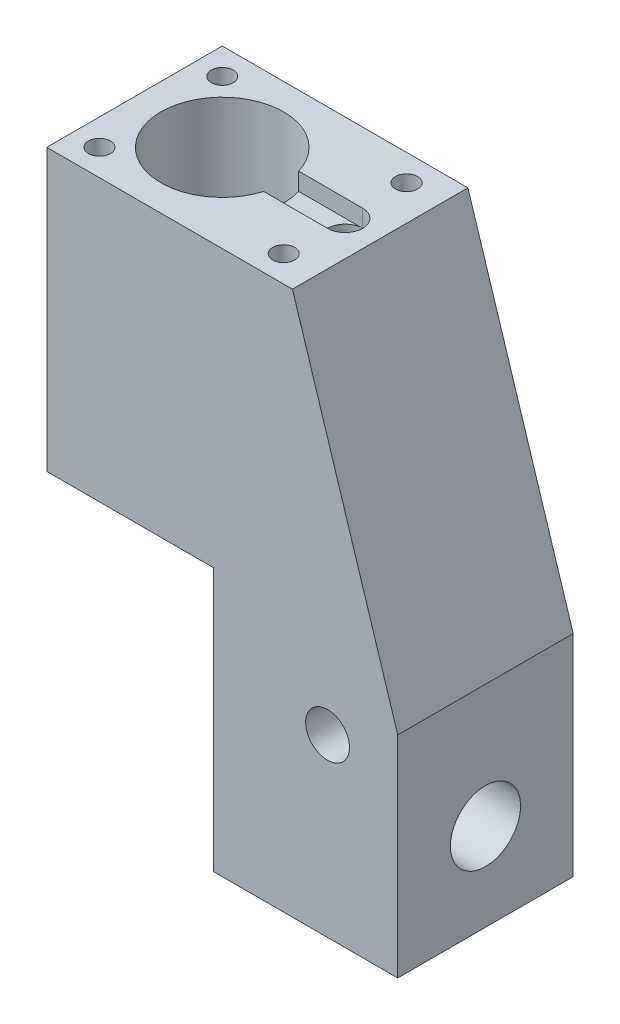
from build123d import *

# Parameters (mm, degrees)
SKETCH1_R             = 2.5
BOSS_EXTRUDE1_DEPTH   = 10
CUT_EXTRUDE1_DEPTH    = 75.458041876
CUT_EXTRUDE2_DEPTH    = 2
M3_TAPPED_HOLE1_D     = 2.5
M3_TAPPED_HOLE1_DEPTH = 9
M3_TAPPED_HOLE1_TIP   = 0.751075774
SKETCH6_R             = 4
CUT_EXTRUDE3_DEPTH    = 75.458041876
SKETCH10_R            = 1.6
CUT_EXTRUDE4_DEPTH    = 8
SKETCH11_R            = 2
CUT_EXTRUDE5_DEPTH    = 20
SKETCH12_R            = 1
CUT_EXTRUDE6_DEPTH    = 29


# Read off the part's stored shape, not the designer's step: M4 Tapped Hole1
with BuildPart() as part:
    # Sketch1 → Boss-Extrude1 (new, symmetric)
    with BuildSketch(Plane.XY):
        Polygon((0, 0), (-21, 0), (-21, 30), (-40, 30), (-40, 62), (-12, 62), (0, 24), align=None)
        with Locations((-8, 20)):
            Circle(SKETCH1_R, mode=Mode.SUBTRACT)
    extrude(amount=BOSS_EXTRUDE1_DEPTH, both=True)

    # Sketch2 → Cut-Extrude1 (cut, through all)
    with BuildSketch(Plane(origin=(0, 62, 0), x_dir=(1, 0, 0), z_dir=(0, 1, 0))):
        with BuildLine():
            ThreePointArc((-23.291796068, -2), (-23.073333142, -1.010587075), (-23, 0))
            Line((-23, 0), (-37, 0))
            ThreePointArc((-37, 0), (-31.010587075, -6.926666858), (-23.291796068, -2))
        make_face()
        with BuildLine():
            Line((-37, 0), (-23, 0))
            ThreePointArc((-23, 0), (-23.073333142, 1.010587075), (-23.291796068, 2))
            ThreePointArc((-23.291796068, 2), (-31.010587075, 6.926666858), (-37, 0))
        make_face()
    extrude(amount=-CUT_EXTRUDE1_DEPTH, mode=Mode.SUBTRACT)

    # Sketch2<3> → Cut-Extrude2 (cut)
    with BuildSketch(Plane(origin=(0, 62, 0), x_dir=(1, 0, 0), z_dir=(0, 1, 0))):
        with BuildLine():
            ThreePointArc((-16, -2), (-17.414213562, -1.414213562), (-18, 0))
            Line((-18, 0), (-23, 0))
            ThreePointArc((-23, 0), (-23.073333142, -1.010587075), (-23.291796068, -2))
            Line((-23.291796068, -2), (-16, -2))
        make_face()
        with BuildLine():
            Line((-23, 0), (-18, 0))
            ThreePointArc((-18, 0), (-17.414213562, 1.414213562), (-16, 2))
            Line((-16, 2), (-23.291796068, 2))
            ThreePointArc((-23.291796068, 2), (-23.073333142, 1.010587075), (-23, 0))
        make_face()
        with BuildLine():
            ThreePointArc((-16, -2), (-14.585786438, -1.414213562), (-14, 0))
            Line((-14, 0), (-18, 0))
            ThreePointArc((-18, 0), (-17.414213562, -1.414213562), (-16, -2))
        make_face()
        with BuildLine():
            Line((-18, 0), (-14, 0))
            ThreePointArc((-14, 0), (-14.585786438, 1.414213562), (-16, 2))
            ThreePointArc((-16, 2), (-17.414213562, 1.414213562), (-18, 0))
        make_face()
    extrude(amount=-CUT_EXTRUDE2_DEPTH, mode=Mode.SUBTRACT)

    # M3 Tapped Hole1
    with Locations(Plane(origin=(0, 62, 0), x_dir=(1, 0, 0), z_dir=(0, 1, 0))):
        with Locations((-37, 7), (-37, -7), (-16, -7), (-16, 7)):
            Hole(M3_TAPPED_HOLE1_D / 2, depth=M3_TAPPED_HOLE1_DEPTH)
            with Locations((0, 0, -(M3_TAPPED_HOLE1_DEPTH + M3_TAPPED_HOLE1_TIP / 2))):  # 118° drill point
                Cone(0, M3_TAPPED_HOLE1_D / 2, M3_TAPPED_HOLE1_TIP, mode=Mode.SUBTRACT)

    # Sketch6 → Cut-Extrude3 (cut, through all)
    with BuildSketch(Plane(origin=(0, 0, 0), x_dir=(0, 0, -1), z_dir=(1, 0, 0))):
        with Locations(Location((0, 10, 0), (0, 0, 90))):
            Circle(SKETCH6_R)
    extrude(amount=-CUT_EXTRUDE3_DEPTH, mode=Mode.SUBTRACT)

    # M4 Tapped Hole1 outline → M4 Tapped Hole1 (revolve, cut)
    with BuildSketch(Plane(origin=(-16, 0, 0), x_dir=(1, 0, 0), z_dir=(0, 0, 1))):
        Polygon((1.65, 0.375), (1.65, 6.356330866), (0, 6.356330866), (0, 0), (2.025, 0), align=None)
    revolve(axis=Axis((-16, 0, 0), (0, 1, 0)), mode=Mode.SUBTRACT)

    # M4 Tapped Hole1 2 outline → M4 Tapped Hole1 2 (revolve, cut)
    with BuildSketch(Plane(origin=(-8, 0, 0), x_dir=(1, 0, 0), z_dir=(0, 0, 1))):
        Polygon((1.65, 0.375), (1.65, 6.356330866), (0, 6.356330866), (0, 0), (2.025, 0), align=None)
    revolve(axis=Axis((-8, 0, 0), (0, 1, 0)), mode=Mode.SUBTRACT)

    # Sketch10 → Cut-Extrude4 (cut)
    with BuildSketch(Plane.ZY.offset(40)):
        with Locations(Location((-3, 45, 0), (0, 0, 270))):
            Circle(SKETCH10_R)
        with Locations(Location((3, 45, 0), (0, 0, 270))):
            Circle(SKETCH10_R)
    extrude(amount=-CUT_EXTRUDE4_DEPTH, mode=Mode.SUBTRACT)

    # Sketch11 → Cut-Extrude5 (cut)
    with BuildSketch(Plane(origin=(0, 60, 0), x_dir=(1, 0, 0), z_dir=(0, 1, 0))):
        with Locations(Location((-16.005152977, 0, 0), (0, 0, 270))):
            Circle(SKETCH11_R)
    extrude(amount=-CUT_EXTRUDE5_DEPTH, mode=Mode.SUBTRACT)

    # Sketch12 → Cut-Extrude6 (cut)
    with BuildSketch(Plane(origin=(0, 40, 0), x_dir=(1, 0, 0), z_dir=(0, 1, 0))):
        with Locations(Location((-16, 0, 0), (0, 0, 270))):
            Circle(SKETCH12_R)
    extrude(amount=-CUT_EXTRUDE6_DEPTH, mode=Mode.SUBTRACT)


solid = part.part
